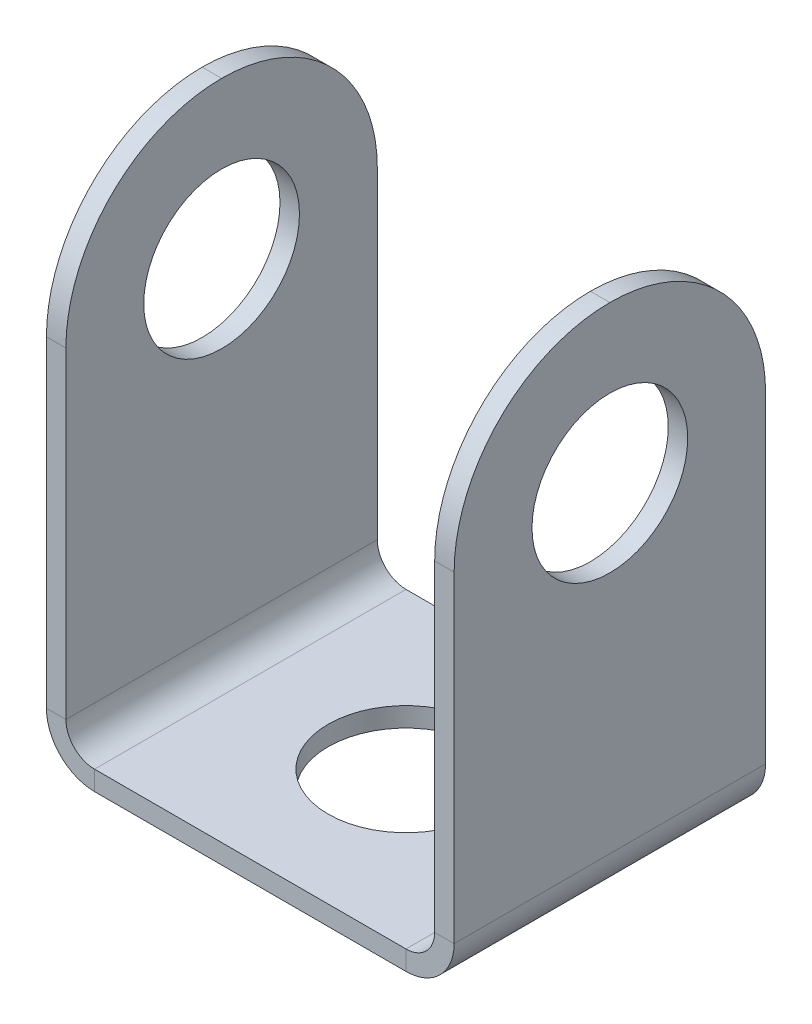
from build123d import *

# Parameters (mm, degrees)
SKETCH1_W          = 8
SKETCH1_H          = 8
BASE_FLANGE1_DEPTH = 0.5
EDGE_FLANGE1_DEPTH = 8
EDGE_FLANGE2_DEPTH = 8
FILLET1_R          = 4
SKETCH12_R         = 2
CUT_EXTRUDE1_DEPTH = 15.574703412
SKETCH13_R         = 2
CUT_EXTRUDE2_DEPTH = 18.548159967


# Sheet-metal steps are written as plain solids
with BuildPart() as part:
    # Sketch1 → Base-Flange1 (new body)
    with BuildSketch(Plane(origin=(0, 0, 0), x_dir=(1, 0, 0), z_dir=(0, 1, 0))):
        Rectangle(SKETCH1_W, SKETCH1_H)
    extrude(amount=BASE_FLANGE1_DEPTH)

    # Edge-Flange1 section (across the edge) → Edge-Flange1 (add)
    with BuildSketch(Plane(origin=(4.7366, 0.5, 4), x_dir=(-1, 0, 0), z_dir=(0, 0, -1))):
        with BuildLine():
            Line((-0.5, 0.7366), (-0.5, 13))
            Line((-0.5, 13), (0, 13))
            Line((0, 13), (0, 0.7366))
            ThreePointArc((0, 0.7366), (0.215745145, 0.215745145), (0.7366, 0))
            Line((0.7366, 0), (0.7366, -0.5))
            ThreePointArc((0.7366, -0.5), (-0.137808246, -0.137808246), (-0.5, 0.7366))
        make_face()
    extrude(amount=EDGE_FLANGE1_DEPTH)

    # Edge-Flange2 section (across the edge) → Edge-Flange2 (add)
    with BuildSketch(Plane(origin=(-4.7366, 0.5, -4), x_dir=(1, 0, 0), z_dir=(0, 0, 1))):
        with BuildLine():
            Line((-0.5, 0.7366), (-0.5, 13))
            Line((-0.5, 13), (0, 13))
            Line((0, 13), (0, 0.7366))
            ThreePointArc((0, 0.7366), (0.215745145, 0.215745145), (0.7366, 0))
            Line((0.7366, 0), (0.7366, -0.5))
            ThreePointArc((0.7366, -0.5), (-0.137808246, -0.137808246), (-0.5, 0.7366))
        make_face()
    extrude(amount=EDGE_FLANGE2_DEPTH)

    # Fillet1
    fillet1_edges = [part.edges().sort_by_distance(p)[0] for p in [
        (4.9866, 13.5, -4),
        (-4.9866, 13.5, -4),
        (4.9866, 13.5, 4),
        (-4.9866, 13.5, 4),
    ]]
    fillet(fillet1_edges, radius=FILLET1_R - 0.0001)  # a hair under: the kernel refuses the full size

    # Sketch12 → Cut-Extrude1 (cut, through all)
    with BuildSketch(Plane(origin=(0, 0.5, 0), x_dir=(1, 0, 0), z_dir=(0, 1, 0))):
        with Locations(Location((0, 0, 0), (0, 0, 270))):
            Circle(SKETCH12_R)
    extrude(amount=-CUT_EXTRUDE1_DEPTH, mode=Mode.SUBTRACT)

    # Sketch13 → Cut-Extrude2 (cut, through all)
    with BuildSketch(Plane(origin=(5.2366, 0, 0), x_dir=(0, 0, -1), z_dir=(1, 0, 0))):
        with Locations(Location((0, 9.484444929, 0), (0, 0, 90))):
            Circle(SKETCH13_R)
    extrude(amount=-CUT_EXTRUDE2_DEPTH, mode=Mode.SUBTRACT)


solid = part.part
